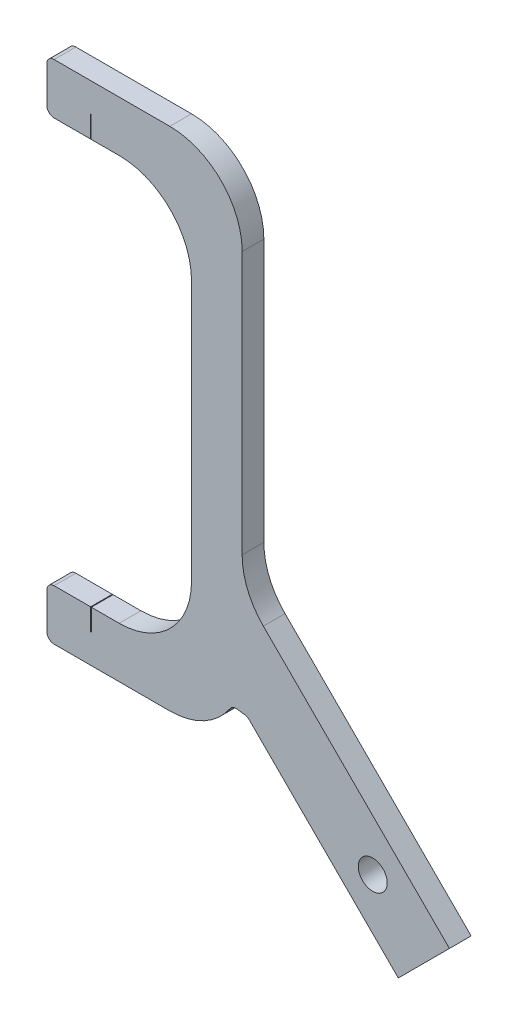
from build123d import *

# Parameters (mm, degrees)
BOSS_EXTRUDE1_DEPTH = 3
SKETCH2_W           = 0.1
SKETCH2_H           = 3
CUT_EXTRUDE1_DEPTH  = 3
SKETCH3_W           = 0.1
SKETCH3_H           = 3
CUT_EXTRUDE2_DEPTH  = 3
SKETCH4_R           = 2
CUT_EXTRUDE3_DEPTH  = 10


with BuildPart() as part:
    # Sketch1 → Boss-Extrude1 (new body)
    with BuildSketch(Plane.XY):
        with BuildLine():
            Line((1, 0), (17, 0))
            ThreePointArc((17, 0), (24.071067812, -2.928932188), (27, -10))
            Line((27, -10), (27, -10.092807276))
            Line((27, -10.092807276), (27, -46.305260908))
            ThreePointArc((27, -46.305260908), (27.761204675, -50.132095232), (29.928932188, -53.37632872))
            Line((29.928932188, -53.37632872), (55.658046858, -79.10544339))
            Line((55.658046858, -79.10544339), (48.586979046, -86.176511202))
            Line((48.586979046, -86.176511202), (27.967147221, -65.556679376))
            ThreePointArc((27.967147221, -65.556679376), (27.702898628, -65.367194486), (27.391825822, -65.272507885))
            Line((27.391825822, -65.272507885), (26.275231594, -65.124062387))
            ThreePointArc((26.275231594, -65.124062387), (25.731520406, -65.20412327), (25.312223829, -65.559400599))
            ThreePointArc((25.312223829, -65.559400599), (21.712005624, -68.820260937), (17, -70))
            Line((17, -70), (1, -70))
            ThreePointArc((1, -70), (0.292893219, -69.707106781), (0, -69))
            Line((0, -69), (0, -64))
            ThreePointArc((0, -64), (0.292893219, -63.292893219), (1, -63))
            Line((1, -63), (10, -63))
            ThreePointArc((10, -63), (17.071067812, -60.071067812), (20, -53))
            Line((20, -53), (20, -17))
            ThreePointArc((20, -17), (17.071067812, -9.928932188), (10, -7))
            Line((10, -7), (1, -7))
            ThreePointArc((1, -7), (0.292893219, -6.707106781), (0, -6))
            Line((0, -6), (0, -1))
            ThreePointArc((0, -1), (0.292893219, -0.292893219), (1, 0))
        make_face()
    extrude(amount=BOSS_EXTRUDE1_DEPTH)

    # Sketch2 → Cut-Extrude1 (cut)
    with BuildSketch(Plane(origin=(0, -63, 0), x_dir=(1, 0, 0), z_dir=(0, 1, 0))):
        with Locations((6.1, -1.5)):
            Rectangle(SKETCH2_W, SKETCH2_H)
    extrude(amount=-CUT_EXTRUDE1_DEPTH, mode=Mode.SUBTRACT)

    # Sketch3 → Cut-Extrude2 (cut)
    with BuildSketch(Plane.XZ.offset(7)):
        with Locations((6.05, 1.5)):
            Rectangle(SKETCH3_W, SKETCH3_H)
    extrude(amount=-CUT_EXTRUDE2_DEPTH, mode=Mode.SUBTRACT)

    # Sketch4 → Cut-Extrude3 (cut)
    with BuildSketch(Plane.XY.offset(3)):
        with Locations((45.05144514, -75.569909484)):
            Circle(SKETCH4_R)
    extrude(amount=-CUT_EXTRUDE3_DEPTH, mode=Mode.SUBTRACT)


solid = part.part
